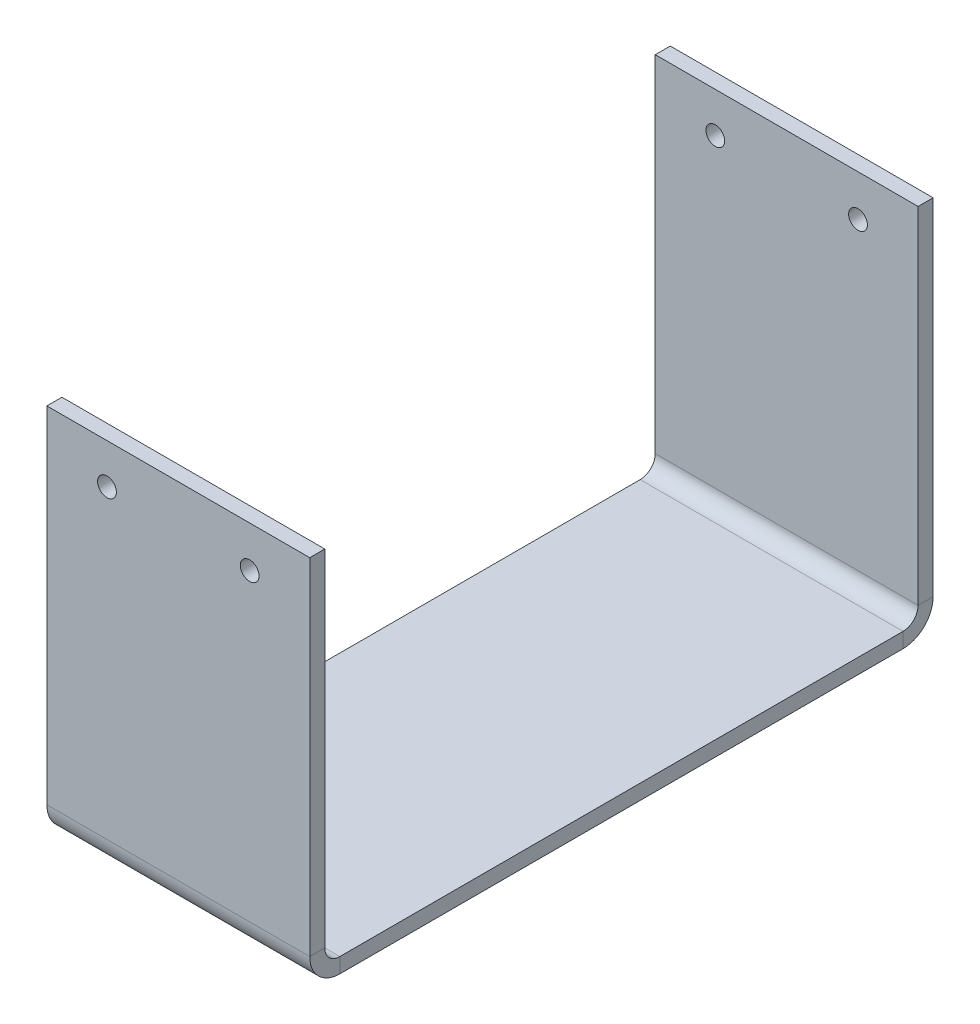
from build123d import *

# Parameters (mm, degrees)
SKETCH1_W                      = 35
SKETCH1_H                      = 83
BASE_FLANGE2_DEPTH             = 2
EDGE_FLANGE3_STRIP_W           = 12
EDGE_FLANGE3_STRIP_H           = 2
EDGE_FLANGE3_STRIP_CUT_DEPTH   = 35
EDGE_FLANGE3_STRIP_2_W         = 12
EDGE_FLANGE3_STRIP_2_H         = 2
EDGE_FLANGE3_STRIP_CUT_2_DEPTH = 35
EDGE_FLANGE3_DEPTH             = 35
EDGE_FLANGE3_BEND_DEPTH        = 35
TAP_DRILL_FOR_M3_TAP1_D        = 2.5


# Sheet-metal steps are written as plain solids
with BuildPart() as part:
    # Sketch1 → Base-Flange2 (new body)
    with BuildSketch(Plane(origin=(0, 0, 0), x_dir=(1, 0, 0), z_dir=(0, 1, 0))):
        Rectangle(SKETCH1_W, SKETCH1_H)
    extrude(amount=-BASE_FLANGE2_DEPTH)

    # Edge-Flange3 strip (across the edge) → Edge-Flange3 strip cut (cut)
    with BuildSketch(Plane(origin=(17.5, 0, -41.5), x_dir=(0, 0, 1), z_dir=(-1, 0, 0))):
        with Locations((-2, -1)):
            Rectangle(EDGE_FLANGE3_STRIP_W, EDGE_FLANGE3_STRIP_H)
    extrude(amount=EDGE_FLANGE3_STRIP_CUT_DEPTH, mode=Mode.SUBTRACT)

    # Edge-Flange3 strip 2 (across the edge) → Edge-Flange3 strip cut 2 (cut)
    with BuildSketch(Plane(origin=(-17.5, 0, 41.5), x_dir=(0, 0, -1), z_dir=(1, 0, 0))):
        with Locations((-2, -1)):
            Rectangle(EDGE_FLANGE3_STRIP_2_W, EDGE_FLANGE3_STRIP_2_H)
    extrude(amount=EDGE_FLANGE3_STRIP_CUT_2_DEPTH, mode=Mode.SUBTRACT)

    # Edge-Flange3 section (across the edge) → Edge-Flange3 (add)
    with BuildSketch(Plane(origin=(17.5, 0, -41.5), x_dir=(0, 0, 1), z_dir=(-1, 0, 0))):
        with BuildLine():
            Line((0, 2), (0, 48))
            Line((0, 48), (2, 48))
            Line((2, 48), (2, 2))
            ThreePointArc((2, 2), (2.585786438, 0.585786438), (4, 0))
            Line((4, 0), (4, -2))
            ThreePointArc((4, -2), (1.171572875, -0.828427125), (0, 2))
        make_face()
    extrude(amount=EDGE_FLANGE3_DEPTH)

    # Edge-Flange3 section 2 (across the edge) → Edge-Flange3 bend (add)
    with BuildSketch(Plane(origin=(-17.5, 0, 41.5), x_dir=(0, 0, -1), z_dir=(1, 0, 0))):
        with BuildLine():
            Line((0, 2), (0, 48))
            Line((0, 48), (2, 48))
            Line((2, 48), (2, 2))
            ThreePointArc((2, 2), (2.585786438, 0.585786438), (4, 0))
            Line((4, 0), (4, -2))
            ThreePointArc((4, -2), (1.171572875, -0.828427125), (0, 2))
        make_face()
    extrude(amount=EDGE_FLANGE3_BEND_DEPTH)

    # Tap Drill for M3 Tap1 (through all)
    with Locations(Plane(origin=(-15.830402425, -23.069767603, -43.5), x_dir=(-1, 0, 0), z_dir=(0, 0, -1))):
        with Locations((-25.330402425, 65.569767603), (-6.330402425, 65.739876607)):
            Hole(TAP_DRILL_FOR_M3_TAP1_D / 2)


solid = part.part
